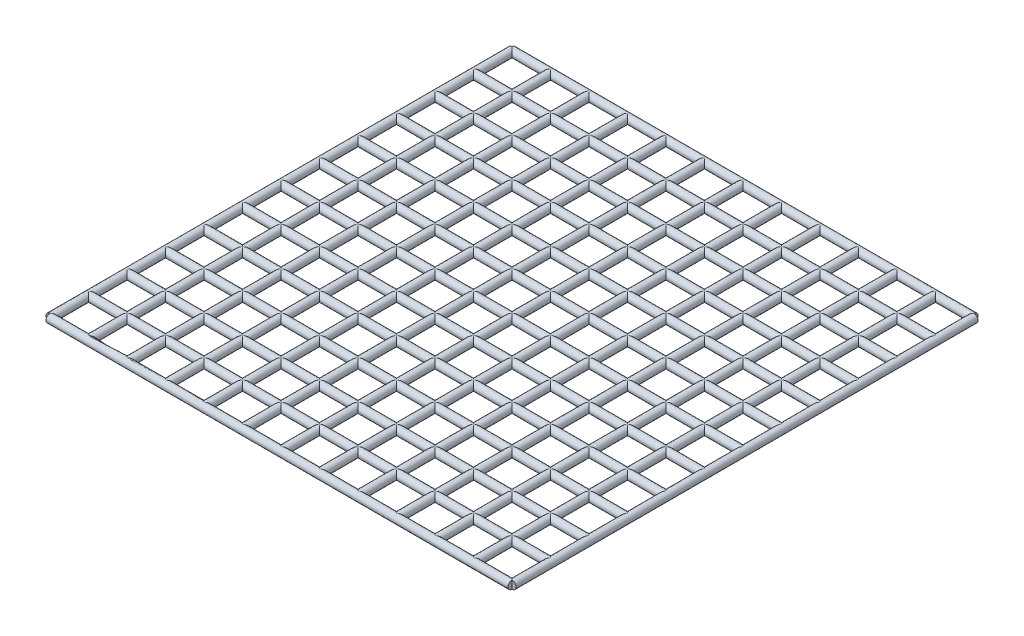
from build123d import *

# Parameters (mm, degrees)
SKETCH1_R           = 1.3335
BOSS_EXTRUDE1_DEPTH = 152.4
SKETCH2_R           = 1.3335
BOSS_EXTRUDE2_DEPTH = 152.4
LPATTERN1_COUNT     = 13
LPATTERN1_PITCH     = 12.7
LPATTERN2_COUNT     = 13
LPATTERN2_PITCH     = 12.7


with BuildPart() as part:
    # Sketch1 → Boss-Extrude1 (new body)
    with BuildSketch(Plane.XY):
        Circle(SKETCH1_R)
    boss_extrude1 = extrude(amount=-BOSS_EXTRUDE1_DEPTH)

    # Sketch2 → Boss-Extrude2 (add)
    with BuildSketch(Plane(origin=(0, 0, 0), x_dir=(0, 0, -1), z_dir=(1, 0, 0))):
        Circle(SKETCH2_R)
    boss_extrude2 = extrude(amount=BOSS_EXTRUDE2_DEPTH)

    # LPattern1: Boss-Extrude1 ×13
    with Locations(*[(i * LPATTERN1_PITCH, 0, 0) for i in range(1, LPATTERN1_COUNT)]):
        add(boss_extrude1)

    # LPattern2: Boss-Extrude2 ×13
    with Locations(*[(0, 0, -i * LPATTERN2_PITCH) for i in range(1, LPATTERN2_COUNT)]):
        add(boss_extrude2)


solid = part.part
